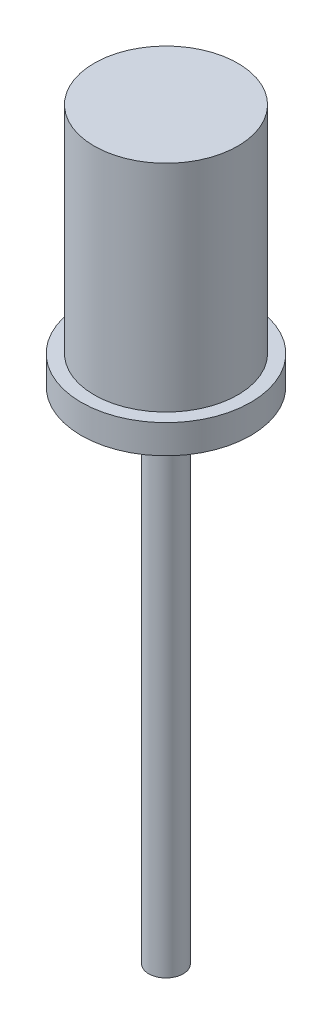
from build123d import *

# Parameters (mm, degrees)
SKETCH1_R           = 2.95
BOSS_EXTRUDE1_DEPTH = 1
SKETCH2_R           = 2.5
BOSS_EXTRUDE2_DEPTH = 7.5
SKETCH3_R           = 0.6
BOSS_EXTRUDE3_DEPTH = 17.4


with BuildPart() as part:
    # Sketch1 → Boss-Extrude1 (new body)
    with BuildSketch(Plane(origin=(0, 0, 0), x_dir=(1, 0, 0), z_dir=(0, 1, 0))):
        Circle(SKETCH1_R)
    extrude(amount=BOSS_EXTRUDE1_DEPTH)

    # Sketch2 → Boss-Extrude2 (add)
    with BuildSketch(Plane(origin=(0, 1, 0), x_dir=(1, 0, 0), z_dir=(0, 1, 0))):
        Circle(SKETCH2_R)
    extrude(amount=BOSS_EXTRUDE2_DEPTH)

    # Sketch3 → Boss-Extrude3 (add)
    with BuildSketch(Plane.XZ):
        Circle(SKETCH3_R)
    extrude(amount=BOSS_EXTRUDE3_DEPTH)


solid = part.part
